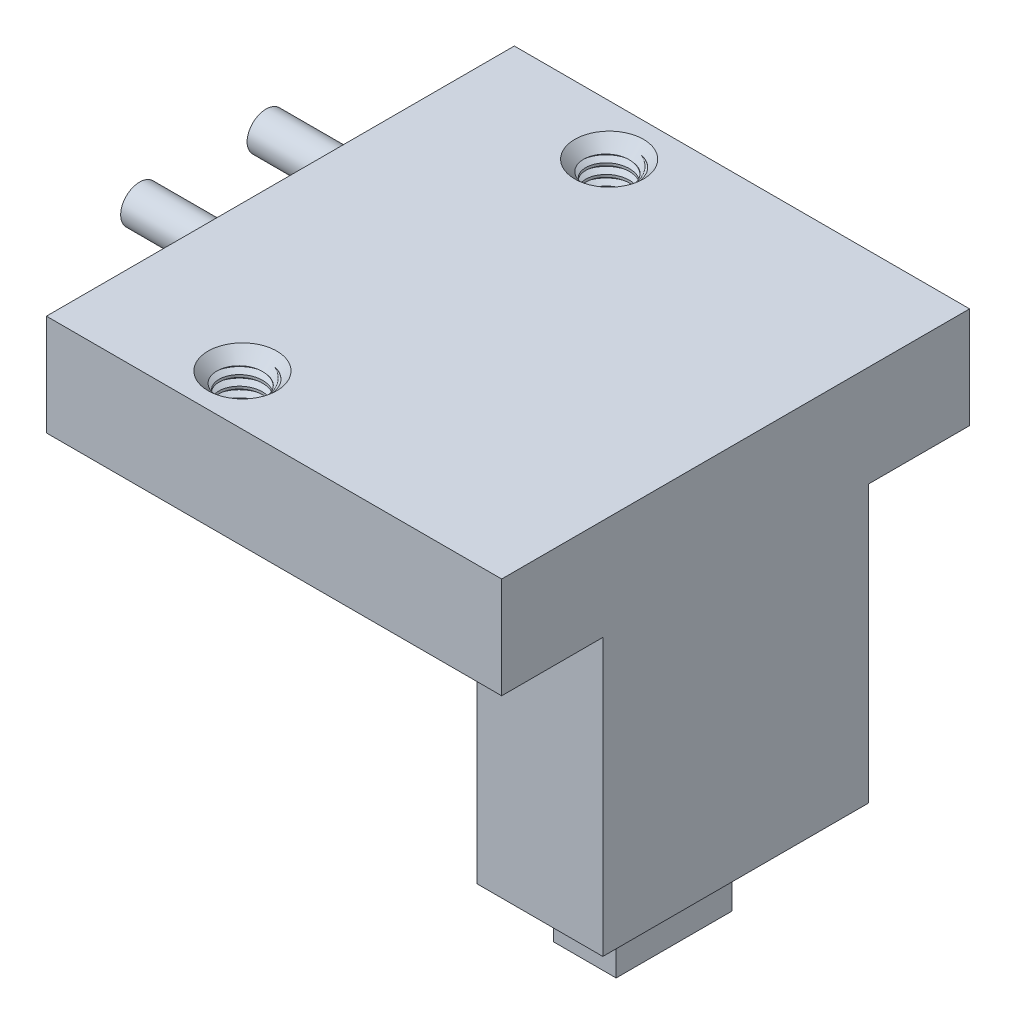
from build123d import *

# Parameters (mm, degrees)
SKETCH1_W                       = 36
SKETCH1_H                       = 37
BOSS_EXTRUDE1_DEPTH             = 5
SKETCH2_W                       = 36
SKETCH2_H                       = 8
BOSS_EXTRUDE2_DEPTH             = 3
SKETCH3_R                       = 1.5
BOSS_EXTRUDE3_DEPTH             = 6
SKETCH18_W                      = 9.95413856
SKETCH18_H                      = 21
BOSS_EXTRUDE8_DEPTH             = 24.85
SKETCH19_W                      = 4.95413856
SKETCH19_H                      = 9.15
BOSS_EXTRUDE9_DEPTH             = 7
F_8_32_TAPPED_HOLE2_D           = 3.4544
F_8_32_TAPPED_HOLE2_DEPTH       = 10.962193539
F_8_32_TAPPED_HOLE2_CSINK_D     = 5.4356
F_8_32_TAPPED_HOLE2_CSINK_ANGLE = 90
F_8_32_TAPPED_HOLE2_TIP         = 1.037806461
THREAD4_PITCH                   = 0.79375
THREAD5_PITCH                   = 0.79375


with BuildPart() as part:
    # Sketch1 → Boss-Extrude1 (new body)
    with BuildSketch(Plane(origin=(0, 0, 0), x_dir=(1, 0, 0), z_dir=(0, 1, 0))):
        with Locations((4.082129674, 12.725585003)):
            Rectangle(SKETCH1_W, SKETCH1_H)
    extrude(amount=BOSS_EXTRUDE1_DEPTH)

    # Sketch2 → Boss-Extrude2 (add)
    with BuildSketch(Plane.XZ):
        with Locations((4.082129674, -27.225585003)):
            Rectangle(SKETCH2_W, SKETCH2_H)
        with Locations((4.082129674, 1.774414997)):
            Rectangle(SKETCH2_W, SKETCH2_H)
    extrude(amount=BOSS_EXTRUDE2_DEPTH)

    # Sketch3 → Boss-Extrude3 (add)
    with BuildSketch(Plane.ZY.offset(13.917870326)):
        with Locations(Location((-17.595585003, 3, 0), (0, 0, 180))):
            Circle(SKETCH3_R)
        with Locations(Location((-7.595585003, 3, 0), (0, 0, 180))):
            Circle(SKETCH3_R)
    extrude(amount=BOSS_EXTRUDE3_DEPTH)

    # Sketch18 → Boss-Extrude8 (add)
    with BuildSketch(Plane.XZ):
        with Locations((17.105060394, -12.725585003)):
            Rectangle(SKETCH18_W, SKETCH18_H)
    extrude(amount=BOSS_EXTRUDE8_DEPTH)

    # Sketch19 → Boss-Extrude9 (add)
    with BuildSketch(Plane.XZ.offset(24.85)):
        with Locations((14.605060394, -12.850585003)):
            Rectangle(SKETCH19_W, SKETCH19_H)
    extrude(amount=BOSS_EXTRUDE9_DEPTH)

    # #8-32 Tapped Hole2
    with Locations(Plane(origin=(0, 5, 0), x_dir=(1, 0, 0), z_dir=(0, 1, 0))):
        with Locations((-2.417870326, 27.225585003), (-2.417870326, -1.774414997)):
            CounterSinkHole(F_8_32_TAPPED_HOLE2_D / 2, F_8_32_TAPPED_HOLE2_CSINK_D / 2, depth=F_8_32_TAPPED_HOLE2_DEPTH, counter_sink_angle=F_8_32_TAPPED_HOLE2_CSINK_ANGLE)
            with Locations((0, 0, -(F_8_32_TAPPED_HOLE2_DEPTH + F_8_32_TAPPED_HOLE2_TIP / 2))):  # 118° drill point
                Cone(0, F_8_32_TAPPED_HOLE2_D / 2, F_8_32_TAPPED_HOLE2_TIP, mode=Mode.SUBTRACT)

    # Thread4: the profile of Thread Profile10 profile screwed along a right-hand helix of 12.598425 turns, 8 arcs to a turn; built about Z, then put on its axis
    thread4_z = Axis((0, 0, 0), (0, 0, 1))
    thread4_corners = [(1.7269, 0, -0.000173205), (2.156829789, 0, 0.248046874), (2.156829789, 0, 0.347265624), (1.7269, 0, 0.595485703)]
    with BuildLine(mode=Mode.PRIVATE) as thread4_profile:
        Line(thread4_corners[0], thread4_corners[1])
        Line(thread4_corners[1], thread4_corners[2])
        Line(thread4_corners[2], thread4_corners[3])
        Line(thread4_corners[3], thread4_corners[0])
    thread4_cap = Face(thread4_profile.wire())
    thread4_turn_angles = [0, 22.5, 45, 67.5, 90, 112.5, 135, 157.5, 180, 202.5, 225, 247.5, 270, 292.5, 315, 337.5, 360]
    thread4_turn_weights = [1, 0.9238795325112867, 1, 0.9238795325112867, 1, 0.9238795325112867, 1, 0.9238795325112867, 1, 0.9238795325112867, 1, 0.9238795325112867, 1, 0.9238795325112867, 1, 0.9238795325112867, 1]
    thread4_turn_rails = [Edge.make_bspline([Vector(p[0], p[1], 0).rotate(thread4_z, thread4_turn_angles[k]) / thread4_turn_weights[k] + Vector(0, 0, p[2] + THREAD4_PITCH * thread4_turn_angles[k] / 360) for k in range(17)], [0, 0, 0, 1, 1, 2, 2, 3, 3, 4, 4, 5, 5, 6, 6, 7, 7, 8, 8, 8], 2, thread4_turn_weights) for p in thread4_corners]
    thread4_turn_sides = [Face.make_surface_from_curves(thread4_turn_rails[p[0]], thread4_turn_rails[p[1]]) for p in [(0, 1), (1, 2), (2, 3), (3, 0)]]
    thread4_last_angles = [4320, 4342.5, 4365, 4387.5, 4410, 4432.5, 4455, 4477.5, 4500, 4517.716535433, 4535.433070866]
    thread4_last_weights = [1, 0.9238795325112867, 1, 0.9238795325112867, 1, 0.9238795325112867, 1, 0.9238795325112867, 1, 0.9525736983244454, 1]
    thread4_last_rails = [Edge.make_bspline([Vector(p[0], p[1], 0).rotate(thread4_z, thread4_last_angles[k]) / thread4_last_weights[k] + Vector(0, 0, p[2] + THREAD4_PITCH * thread4_last_angles[k] / 360) for k in range(11)], [0, 0, 0, 1, 1, 2, 2, 3, 3, 4, 4, 5, 5, 5], 2, thread4_last_weights) for p in thread4_corners]
    thread4_last_sides = [Face.make_surface_from_curves(thread4_last_rails[p[0]], thread4_last_rails[p[1]]) for p in [(0, 1), (1, 2), (2, 3), (3, 0)]]
    thread4 = Plane(origin=(-2.417870326, 5.0094, -27.225585003), x_dir=(-1, 0, 0), z_dir=(0, -1, 0)) * Solid(Shell([*[p.moved(Location((0, 0, THREAD4_PITCH * i))) for i in range(12) for p in thread4_turn_sides], *thread4_last_sides, thread4_cap, thread4_cap.rotate(thread4_z, 4535.433070866).moved(Location((0, 0, THREAD4_PITCH * 4535.433070866 / 360)))]))
    add(thread4, mode=Mode.SUBTRACT)

    # Thread5: the profile of Thread Profile11 profile screwed along a right-hand helix of 12.598425 turns, 8 arcs to a turn; built about Z, then put on its axis
    thread5_z = Axis((0, 0, 0), (0, 0, 1))
    thread5_corners = [(1.7269, 0, -0.000173205), (2.156829789, 0, 0.248046874), (2.156829789, 0, 0.347265624), (1.7269, 0, 0.595485703)]
    with BuildLine(mode=Mode.PRIVATE) as thread5_profile:
        Line(thread5_corners[0], thread5_corners[1])
        Line(thread5_corners[1], thread5_corners[2])
        Line(thread5_corners[2], thread5_corners[3])
        Line(thread5_corners[3], thread5_corners[0])
    thread5_cap = Face(thread5_profile.wire())
    thread5_turn_angles = [0, 22.5, 45, 67.5, 90, 112.5, 135, 157.5, 180, 202.5, 225, 247.5, 270, 292.5, 315, 337.5, 360]
    thread5_turn_weights = [1, 0.9238795325112867, 1, 0.9238795325112867, 1, 0.9238795325112867, 1, 0.9238795325112867, 1, 0.9238795325112867, 1, 0.9238795325112867, 1, 0.9238795325112867, 1, 0.9238795325112867, 1]
    thread5_turn_rails = [Edge.make_bspline([Vector(p[0], p[1], 0).rotate(thread5_z, thread5_turn_angles[k]) / thread5_turn_weights[k] + Vector(0, 0, p[2] + THREAD5_PITCH * thread5_turn_angles[k] / 360) for k in range(17)], [0, 0, 0, 1, 1, 2, 2, 3, 3, 4, 4, 5, 5, 6, 6, 7, 7, 8, 8, 8], 2, thread5_turn_weights) for p in thread5_corners]
    thread5_turn_sides = [Face.make_surface_from_curves(thread5_turn_rails[p[0]], thread5_turn_rails[p[1]]) for p in [(0, 1), (1, 2), (2, 3), (3, 0)]]
    thread5_last_angles = [4320, 4342.5, 4365, 4387.5, 4410, 4432.5, 4455, 4477.5, 4500, 4517.716535433, 4535.433070866]
    thread5_last_weights = [1, 0.9238795325112867, 1, 0.9238795325112867, 1, 0.9238795325112867, 1, 0.9238795325112867, 1, 0.9525736983244454, 1]
    thread5_last_rails = [Edge.make_bspline([Vector(p[0], p[1], 0).rotate(thread5_z, thread5_last_angles[k]) / thread5_last_weights[k] + Vector(0, 0, p[2] + THREAD5_PITCH * thread5_last_angles[k] / 360) for k in range(11)], [0, 0, 0, 1, 1, 2, 2, 3, 3, 4, 4, 5, 5, 5], 2, thread5_last_weights) for p in thread5_corners]
    thread5_last_sides = [Face.make_surface_from_curves(thread5_last_rails[p[0]], thread5_last_rails[p[1]]) for p in [(0, 1), (1, 2), (2, 3), (3, 0)]]
    thread5 = Plane(origin=(-2.417870326, 5.0094, 1.774414997), x_dir=(-1, 0, 0), z_dir=(0, -1, 0)) * Solid(Shell([*[p.moved(Location((0, 0, THREAD5_PITCH * i))) for i in range(12) for p in thread5_turn_sides], *thread5_last_sides, thread5_cap, thread5_cap.rotate(thread5_z, 4535.433070866).moved(Location((0, 0, THREAD5_PITCH * 4535.433070866 / 360)))]))
    add(thread5, mode=Mode.SUBTRACT)


solid = part.part
